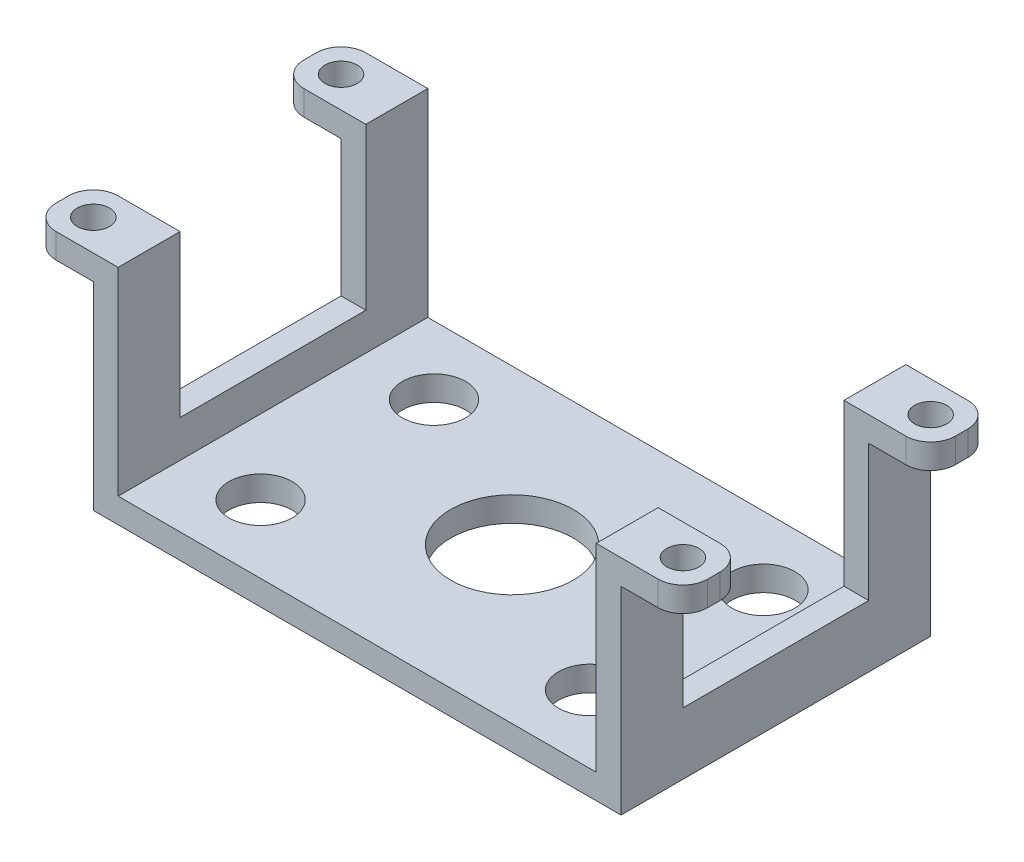
from build123d import *

# Parameters (mm, degrees)
SZKIC1_W                        = 42.6
SZKIC1_H                        = 25
DODANIE_WYCI_GNI_CIE2_DEPTH     = 18
SKORUPA5_T                      = -2
SZKIC2_R                        = 1.3
DODANIE_WYCI_GNI_CIE3_DEPTH     = 2
SZKIC3_R                        = 4.95
SZKIC3_R_2                      = 2.55
WYTNIJ_WYCI_GNI_CIE1_DEPTH      = 2
WYTNIJ_WYCI_GNI_CIE2_DEPTH      = 53.402385442
WYTNIJ_WYCI_GNI_CIE2_DEPTH_BACK = 53.402385442
SZKIC4_W                        = 15
SZKIC4_H                        = 13


with BuildPart() as part:
    # Szkic1 → Dodanie-wyciągnięcie2 (new body)
    with BuildSketch(Plane(origin=(0, 0, 0), x_dir=(1, 0, 0), z_dir=(0, 1, 0))):
        Rectangle(SZKIC1_W, SZKIC1_H)
    extrude(amount=DODANIE_WYCI_GNI_CIE2_DEPTH)

    # Skorupa5
    skorupa5_openings = [part.faces().sort_by_distance(p)[0] for p in [
        (0, 9, -12.5),
        (0, 9, 12.5),
        (0, 18, 0),
    ]]
    offset(amount=SKORUPA5_T, openings=skorupa5_openings, kind=Kind.INTERSECTION)

    # Szkic2 → Dodanie-wyciągnięcie3 (add)
    # profile 1 of 4: a face of its own
    with BuildSketch(Plane(origin=(0, 18, 0), x_dir=(1, 0, 0), z_dir=(0, 1, 0))):
        with BuildLine():
            Line((-21.3, 12.5), (-24.3, 12.5))
            ThreePointArc((-24.3, 12.5), (-25.714213562, 11.914213562), (-26.3, 10.5))
            Line((-26.3, 10.5), (-26.3, 9.5))
            ThreePointArc((-26.3, 9.5), (-25.714213562, 8.085786438), (-24.3, 7.5))
            Line((-24.3, 7.5), (-21.3, 7.5))
            Line((-21.3, 7.5), (-21.3, 12.5))
        make_face()
        with Locations((-23.8, 10)):
            Circle(SZKIC2_R, mode=Mode.SUBTRACT)
    # profile 2 of 4: a face of its own
    with BuildSketch(Plane(origin=(0, 18, 0), x_dir=(1, 0, 0), z_dir=(0, 1, 0))):
        with BuildLine():
            Line((-21.3, -7.5), (-24.3, -7.5))
            ThreePointArc((-24.3, -7.5), (-25.714213562, -8.085786438), (-26.3, -9.5))
            Line((-26.3, -9.5), (-26.3, -10.5))
            ThreePointArc((-26.3, -10.5), (-25.714213562, -11.914213562), (-24.3, -12.5))
            Line((-24.3, -12.5), (-21.3, -12.5))
            Line((-21.3, -12.5), (-21.3, -7.5))
        make_face()
        with Locations((-23.8, -10)):
            Circle(SZKIC2_R, mode=Mode.SUBTRACT)
    # profile 3 of 4: a face of its own
    with BuildSketch(Plane(origin=(0, 18, 0), x_dir=(1, 0, 0), z_dir=(0, 1, 0))):
        with BuildLine():
            Line((21.3, -12.5), (21.3, -7.5))
            Line((21.3, -7.5), (24.3, -7.5))
            ThreePointArc((24.3, -7.5), (25.714213562, -8.085786438), (26.3, -9.5))
            Line((26.3, -9.5), (26.3, -10.5))
            ThreePointArc((26.3, -10.5), (25.714213562, -11.914213562), (24.3, -12.5))
            Line((24.3, -12.5), (21.3, -12.5))
        make_face()
        with Locations((23.8, -10)):
            Circle(SZKIC2_R, mode=Mode.SUBTRACT)
    # profile 4 of 4: a face of its own
    with BuildSketch(Plane(origin=(0, 18, 0), x_dir=(1, 0, 0), z_dir=(0, 1, 0))):
        with BuildLine():
            Line((21.3, 7.5), (24.3, 7.5))
            ThreePointArc((24.3, 7.5), (25.714213562, 8.085786438), (26.3, 9.5))
            Line((26.3, 9.5), (26.3, 10.5))
            ThreePointArc((26.3, 10.5), (25.714213562, 11.914213562), (24.3, 12.5))
            Line((24.3, 12.5), (21.3, 12.5))
            Line((21.3, 12.5), (21.3, 7.5))
        make_face()
        with Locations((23.8, 10)):
            Circle(SZKIC2_R, mode=Mode.SUBTRACT)
    extrude(amount=-DODANIE_WYCI_GNI_CIE3_DEPTH)

    # Szkic3 → Wytnij-wyciągnięcie1 (cut)
    with BuildSketch(Plane(origin=(0, 2, 0), x_dir=(1, 0, 0), z_dir=(0, 1, 0))):
        Circle(SZKIC3_R)
        with Locations((13.3, 7)):
            Circle(SZKIC3_R_2)
        with Locations((-13.3, -7)):
            Circle(SZKIC3_R_2)
        with Locations((13.3, -7)):
            Circle(SZKIC3_R_2)
        with Locations((-13.3, 7)):
            Circle(SZKIC3_R_2)
    extrude(amount=-WYTNIJ_WYCI_GNI_CIE1_DEPTH, mode=Mode.SUBTRACT)

    # Szkic4 → Wytnij-wyciągnięcie2 (cut, two sides: drawn at the far end of the back side and taken through both)
    with BuildSketch(Plane.ZY.offset(21.3).offset(-WYTNIJ_WYCI_GNI_CIE2_DEPTH_BACK)):
        with Locations((0, 11.5)):
            Rectangle(SZKIC4_W, SZKIC4_H)
    extrude(amount=WYTNIJ_WYCI_GNI_CIE2_DEPTH + WYTNIJ_WYCI_GNI_CIE2_DEPTH_BACK, mode=Mode.SUBTRACT)


solid = part.part
